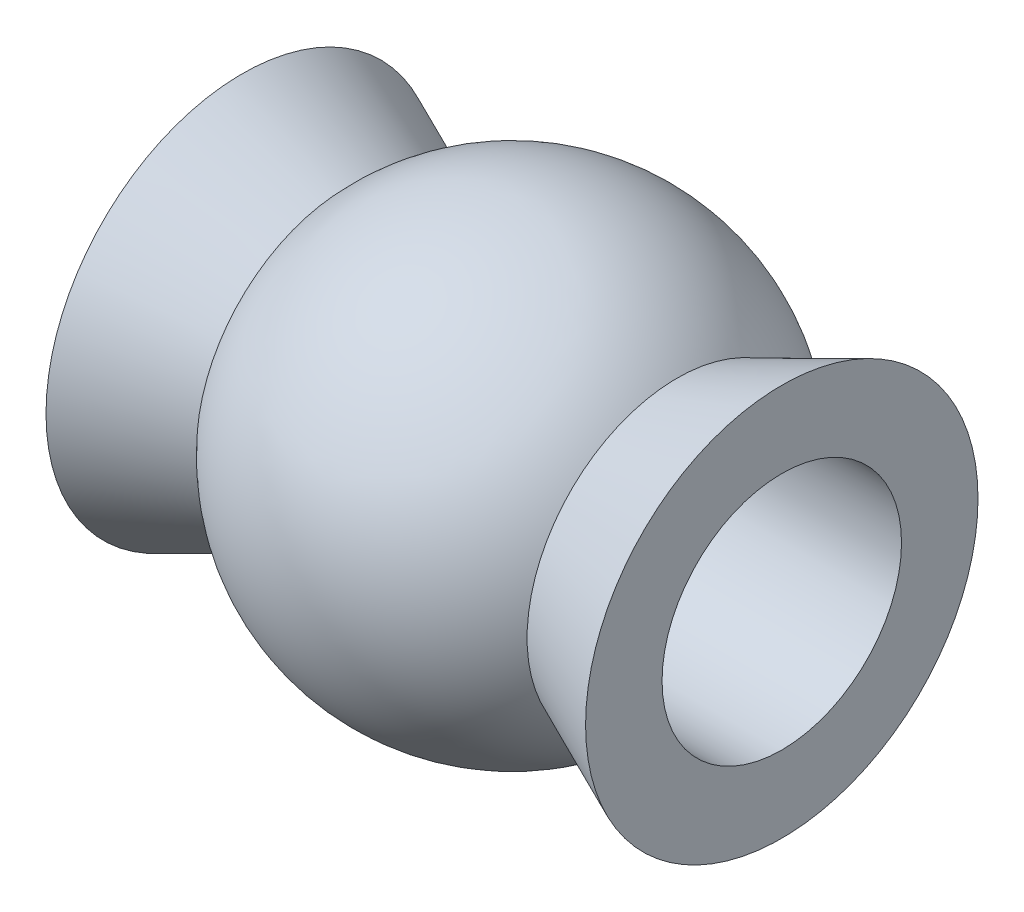
from build123d import *

# Parameters (mm, degrees)
SKETCH2_R          = 1.55
CUT_EXTRUDE1_DEPTH = 10


with BuildPart() as part:
    # Sketch1 → Revolve1 (revolve)
    with BuildSketch(Plane(origin=(0, 0, 0), x_dir=(1, 0, 0), z_dir=(0, 1, 0))):
        with BuildLine():
            Line((3.4925, 0), (3.4925, 2.54))
            Line((3.4925, 2.54), (2.138253482, 1.9431))
            ThreePointArc((2.138253482, 1.9431), (0, 2.88925), (-2.138253482, 1.9431))
            Line((-2.138253482, 1.9431), (-3.4925, 2.54))
            Line((-3.4925, 2.54), (-3.4925, 0))
            Line((-3.4925, 0), (3.4925, 0))
        make_face()
    revolve(axis=Axis((-3.4925, 0, 0), (1, 0, 0)))

    # Sketch2 → Cut-Extrude1 (cut)
    with BuildSketch(Plane.ZY.offset(3.4925)):
        Circle(SKETCH2_R)
    extrude(amount=-CUT_EXTRUDE1_DEPTH, mode=Mode.SUBTRACT)


solid = part.part
